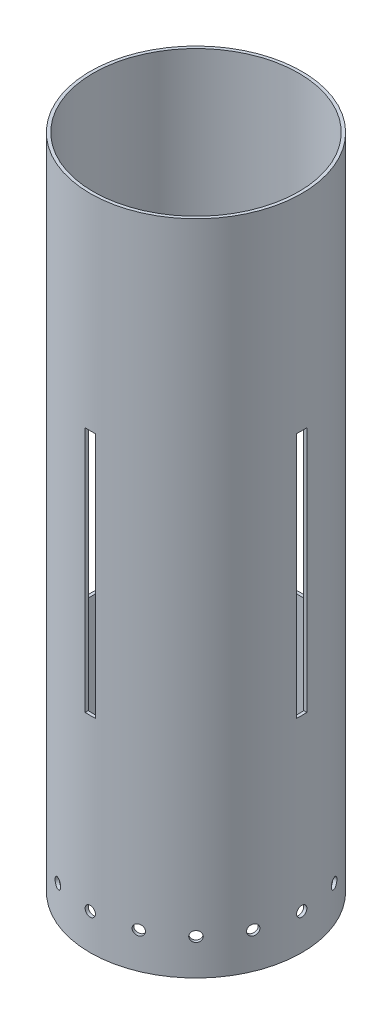
from build123d import *

# Parameters (mm, degrees)
SKETCH1_R           = 65.405
SKETCH1_R_2         = 63.5
BOSS_EXTRUDE1_DEPTH = 406.4
SKETCH2_W           = 6.35
SKETCH2_H           = 152.4
CUT_EXTRUDE2_DEPTH  = 2.54
CIRPATTERN1_COUNT   = 4
CUT_EXTRUDE3_REACH  = 433.914
SKETCH4_R           = 3.175
CIRPATTERN2_COUNT   = 16


with BuildPart() as part:
    # Sketch1 → Boss-Extrude1 (new body)
    with BuildSketch(Plane(origin=(0, 0, 0), x_dir=(1, 0, 0), z_dir=(0, 1, 0))):
        Circle(SKETCH1_R)
        Circle(SKETCH1_R_2, mode=Mode.SUBTRACT)
    extrude(amount=-BOSS_EXTRUDE1_DEPTH)

    # Sketch2 → Cut-Extrude2 (cut)
    with BuildSketch(Plane.XY.offset(65.405)):
        with Locations((0, -203.2)):
            Rectangle(SKETCH2_W, SKETCH2_H)
    cut_extrude2 = extrude(amount=-CUT_EXTRUDE2_DEPTH, mode=Mode.SUBTRACT)

    # CirPattern1: Cut-Extrude2 ×4 about axis
    cirpattern1_axis = Axis((0, -406.4, 0), (0, 1, 0))
    for i in range(1, CIRPATTERN1_COUNT):
        add(cut_extrude2.rotate(cirpattern1_axis, i * 360 / CIRPATTERN1_COUNT), mode=Mode.SUBTRACT)

    # Sketch4 → Cut-Extrude3 (cut, up to next)
    with BuildSketch(Plane.XY.offset(65.405), mode=Mode.PRIVATE) as cut_extrude3_sk1:
        with Locations((0, -384.175)):
            Circle(SKETCH4_R)
    cut_extrude3_tool1 = extrude(cut_extrude3_sk1.sketch, amount=-CUT_EXTRUDE3_REACH, mode=Mode.PRIVATE) & part.part
    cut_extrude3 = cut_extrude3_tool1.solids().sort_by_distance((0, -384.175, 65.405))[0]
    add(cut_extrude3, mode=Mode.SUBTRACT)

    # CirPattern2: Cut-Extrude3 ×16 about axis
    cirpattern2_axis = Axis((0, -406.4, 0), (0, 1, 0))
    for i in range(1, CIRPATTERN2_COUNT):
        add(cut_extrude3.rotate(cirpattern2_axis, i * 360 / CIRPATTERN2_COUNT), mode=Mode.SUBTRACT)


solid = part.part
